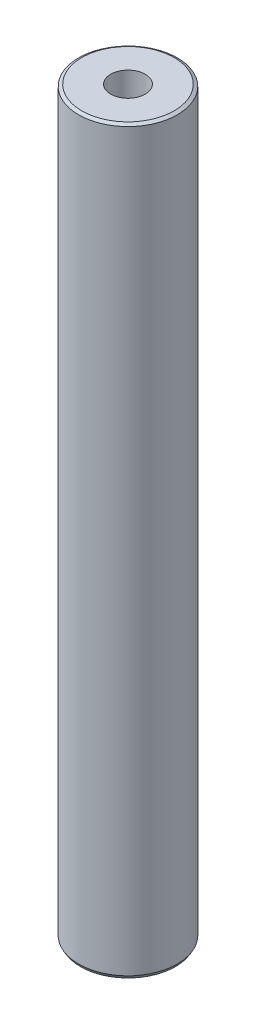
from build123d import *
from OCP.BRepFilletAPI import BRepFilletAPI_MakeChamfer

# Parameters (mm, degrees)
SKETCH1_R           = 40
BOSS_EXTRUDE1_DEPTH = 600
SKETCH2_R           = 13.999732571
CUT_EXTRUDE1_DEPTH  = 603.660766933
CHAMFER1_SIZE       = 1.486133225
CHAMFER1_SIZE2      = 2.574058253


with BuildPart() as part:
    # Sketch1 → Boss-Extrude1 (new body)
    with BuildSketch(Plane(origin=(0, 0, 0), x_dir=(1, 0, 0), z_dir=(0, 1, 0))):
        Circle(SKETCH1_R)
    extrude(amount=BOSS_EXTRUDE1_DEPTH)

    # Sketch2 → Cut-Extrude1 (cut, through all)
    with BuildSketch(Plane(origin=(0, 0, 0), x_dir=(1, 0, 0), z_dir=(0, 1, 0))):
        Circle(SKETCH2_R)
    extrude(amount=CUT_EXTRUDE1_DEPTH, mode=Mode.SUBTRACT)

    # Chamfer1: one chamfer whose edges measure the first distance from different faces: ONE call of the kernel's chamfer builder (chamfer() names one face for all edges)
    chamfer1_edges_1 = [part.edges().sort_by_distance(p)[0] for p in [
        (-40, 600, 0),
    ]]
    chamfer1_side_1 = [part.faces().sort_by_distance(p)[0] for p in [
        (-40, 300, 0),
    ]]
    chamfer1_edges_2 = [part.edges().sort_by_distance(p)[0] for p in [
        (-40, 0, 0),
    ]]
    chamfer1_side_2 = [part.faces().sort_by_distance(p)[0] for p in [
        (-38.86862915, 0, 0),
    ]]
    chamfer1 = BRepFilletAPI_MakeChamfer(part.part.solid().wrapped)
    for e in chamfer1_edges_1:
        chamfer1.Add(CHAMFER1_SIZE, CHAMFER1_SIZE2, e.wrapped, chamfer1_side_1[0].wrapped)  # the first distance lies on this face
    for e in chamfer1_edges_2:
        chamfer1.Add(CHAMFER1_SIZE, CHAMFER1_SIZE2, e.wrapped, chamfer1_side_2[0].wrapped)  # the first distance lies on this face
    add(Compound.cast(chamfer1.Shape()), mode=Mode.REPLACE)


solid = part.part
